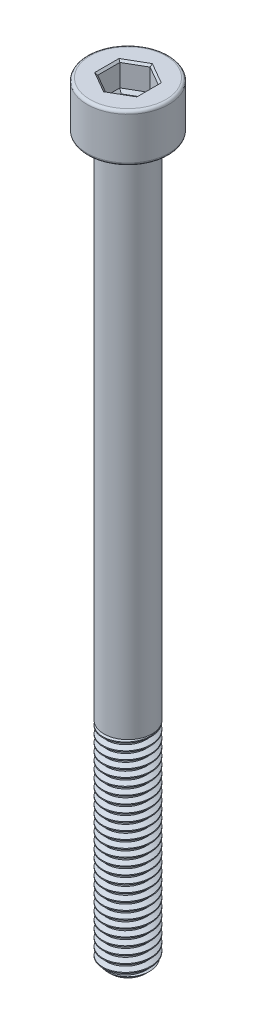
from build123d import *

# Parameters (mm, degrees)
SKETCH1_R           = 2.5
BOSS_EXTRUDE1_DEPTH = 22
THREAD1_PITCH       = 0.8
SKETCH2_R           = 2.5
BOSS_EXTRUDE2_DEPTH = 53
SKETCH3_R           = 4.25
BOSS_EXTRUDE3_DEPTH = 5
FILLET1_R           = 0.3
CUT_EXTRUDE1_DEPTH  = 2.5
CHAMFER1_SIZE       = 0.2
CUT_EXTRUDE2_DEPTH  = 0.3
CUT_EXTRUDE2_DRAFT  = -45


with BuildPart() as part:
    # Sketch1 → Boss-Extrude1 (new body)
    with BuildSketch(Plane(origin=(0, 0, 0), x_dir=(1, 0, 0), z_dir=(0, 1, 0))):
        with Locations(Location((0, 0, 0), (0, 0, 270))):
            Circle(SKETCH1_R)
    extrude(amount=BOSS_EXTRUDE1_DEPTH)

    # Thread1: arcs per turn and ends read off the stored shape
    # Thread1: the profile of Thread Profile1 profile screwed along a right-hand helix through 30 turns, 8 arcs to a turn; built about Z, then put on its axis
    thread1_z = Axis((0, 0, 0), (0, 0, 1))
    thread1_corners = [(2.5003, 0, -0.000173205), (2.5003, 0, 0.700173203), (2.0669873, 0, 0.449999999), (2.0669873, 0, 0.249999999)]
    with BuildLine(mode=Mode.PRIVATE) as thread1_profile:
        Line(thread1_corners[0], thread1_corners[1])
        Line(thread1_corners[1], thread1_corners[2])
        Line(thread1_corners[2], thread1_corners[3])
        Line(thread1_corners[3], thread1_corners[0])
    thread1_cap = Face(thread1_profile.wire())
    thread1_turn_angles = [0, 22.5, 45, 67.5, 90, 112.5, 135, 157.5, 180, 202.5, 225, 247.5, 270, 292.5, 315, 337.5, 360]
    thread1_turn_weights = [1, 0.9238795325112867, 1, 0.9238795325112867, 1, 0.9238795325112867, 1, 0.9238795325112867, 1, 0.9238795325112867, 1, 0.9238795325112867, 1, 0.9238795325112867, 1, 0.9238795325112867, 1]
    thread1_turn_rails = [Edge.make_bspline([Vector(p[0], p[1], 0).rotate(thread1_z, thread1_turn_angles[k]) / thread1_turn_weights[k] + Vector(0, 0, p[2] + THREAD1_PITCH * thread1_turn_angles[k] / 360) for k in range(17)], [0, 0, 0, 1, 1, 2, 2, 3, 3, 4, 4, 5, 5, 6, 6, 7, 7, 8, 8, 8], 2, thread1_turn_weights) for p in thread1_corners]
    thread1_turn_sides = [Face.make_surface_from_curves(thread1_turn_rails[p[0]], thread1_turn_rails[p[1]]) for p in [(0, 1), (1, 2), (2, 3), (3, 0)]]
    thread1 = Plane(origin=(0, 23, 0), x_dir=(-1, 0, 0), z_dir=(0, -1, 0)) * Solid(Shell([*[p.moved(Location((0, 0, THREAD1_PITCH * i))) for i in range(30) for p in thread1_turn_sides], thread1_cap, thread1_cap.rotate(thread1_z, 10800).moved(Location((0, 0, THREAD1_PITCH * 10800 / 360)))]))
    add(thread1, mode=Mode.SUBTRACT)

    # Sketch2 → Boss-Extrude2 (add)
    with BuildSketch(Plane(origin=(0, 22, 0), x_dir=(1, 0, 0), z_dir=(0, 1, 0))):
        with Locations(Location((0, 0, 0), (0, 0, 90))):
            Circle(SKETCH2_R)
    extrude(amount=BOSS_EXTRUDE2_DEPTH)

    # Sketch3 → Boss-Extrude3 (add)
    with BuildSketch(Plane(origin=(0, 75, 0), x_dir=(1, 0, 0), z_dir=(0, 1, 0))):
        with Locations(Location((0, 0, 0), (0, 0, 270))):
            Circle(SKETCH3_R)
    extrude(amount=BOSS_EXTRUDE3_DEPTH)

    # Fillet1
    fillet1_edges = [part.edges().sort_by_distance(p)[0] for p in [
        (0, 75, -4.25),
        (0, 80, -4.25),
    ]]
    fillet(fillet1_edges, radius=FILLET1_R)

    # Sketch4 → Cut-Revolve1 (revolve, cut)
    with BuildSketch(Plane.XY, mode=Mode.PRIVATE) as cut_revolve1_sk:
        Polygon((2.51, 0), (2.51, 0.7), (1.81, 0), align=None)
    revolve(cut_revolve1_sk.sketch.rotate(Axis((0, 0, 0), (0, 1, 0)), 90), axis=Axis((0, 0, 0), (0, 1, 0)), mode=Mode.SUBTRACT)

    # Sketch5 → Cut-Extrude1 (cut)
    with BuildSketch(Plane(origin=(0, 80, 0), x_dir=(1, 0, 0), z_dir=(0, 1, 0))):
        Polygon((0, 2.309401077), (-2, 1.154700538), (-2, -1.154700538), (0, -2.309401077), (2, -1.154700538), (2, 1.154700538), align=None)
    extrude(amount=-CUT_EXTRUDE1_DEPTH, mode=Mode.SUBTRACT)

    # Chamfer1
    chamfer1_edges = [part.edges().sort_by_distance(p)[0] for p in [
        (1, 80, -1.732050808),
        (-1, 80, -1.732050808),
        (-2, 80, 0),
        (-1, 80, 1.732050808),
        (1, 80, 1.732050808),
        (2, 80, 0),
    ]]
    chamfer(chamfer1_edges, length=CHAMFER1_SIZE)


with BuildPart() as cut_extrude2_tool:
    # Sketch6 → Cut-Extrude2 (with draft: the straight prism first)
    with BuildSketch(Plane(origin=(0, 77.5, 0), x_dir=(1, 0, 0), z_dir=(0, 1, 0))):
        Polygon((0, 2.309401077), (-2, 1.154700538), (-2, -1.154700538), (0, -2.309401077), (2, -1.154700538), (2, 1.154700538), align=None)
    extrude(amount=-CUT_EXTRUDE2_DEPTH)
    # Cut-Extrude2: the draft: its side faces are tilted about the plane it starts from
    cut_extrude2_sides = [cut_extrude2_tool.faces().sort_by_distance(p)[0] for p in [
        (-1, 77.35, -1.732050808),
        (-2, 77.35, 0),
        (-1, 77.35, 1.732050808),
        (1, 77.35, 1.732050808),
        (2, 77.35, 0),
        (1, 77.35, -1.732050808),
    ]]
    draft(cut_extrude2_sides, Plane(origin=(0, 77.5, 0), x_dir=(1, 0, 0), z_dir=(0, 1, 0)), CUT_EXTRUDE2_DRAFT)


with BuildPart() as part_1:
    add(part.part)

    # Cut-Extrude2: cut by cut_extrude2_tool
    add(cut_extrude2_tool.part, mode=Mode.SUBTRACT)


solid = part_1.part
